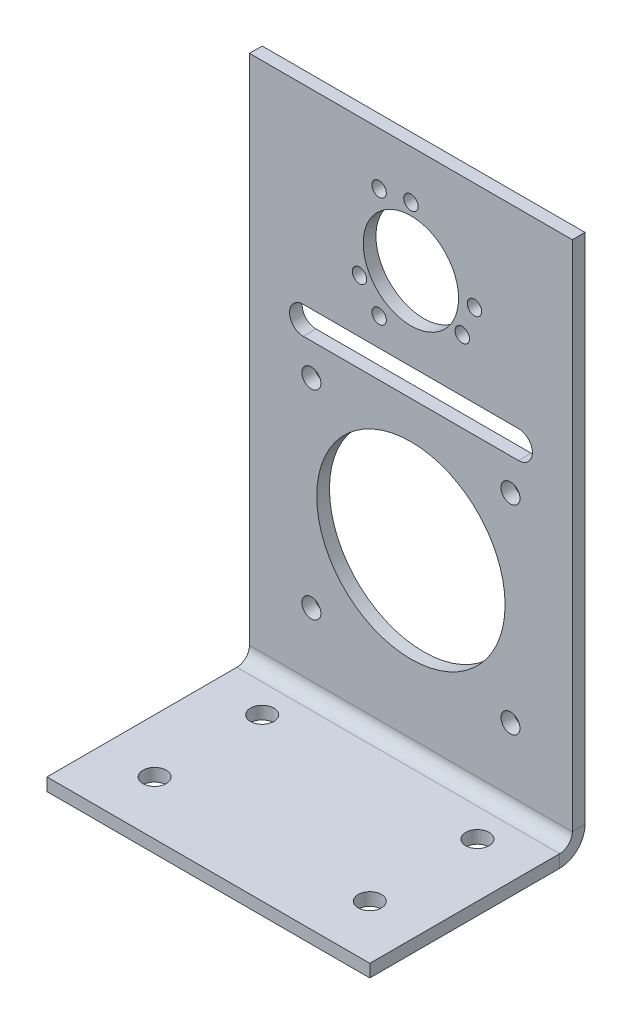
from build123d import *

# Parameters (mm, degrees)
SKETCH1_W                    = 76.2
SKETCH1_H                    = 50.8
BASE_FLANGE1_DEPTH           = 3
EDGE_FLANGE1_STRIP_W         = 18
EDGE_FLANGE1_STRIP_H         = 3
EDGE_FLANGE1_STRIP_CUT_DEPTH = 76.2
EDGE_FLANGE1_DEPTH           = 76.2
UNFOLD1_START                = -38.1
UNFOLD1_DEPTH                = 76.2
UNFOLD1_2_DEPTH              = 76.2
M5_CLEARANCE_HOLE1_D         = 5.5
M4_CLEARANCE_HOLE1_D         = 4.5
SKETCH15_R                   = 22.225
CUT_EXTRUDE1_DEPTH           = 153.340385686
M3_CLEARANCE_HOLE1_D         = 3.4
CIRPATTERN1_COUNT            = 3
SKETCH19_R                   = 11.25
CUT_EXTRUDE2_DEPTH           = 153.340385686
FOLD1_START                  = -147.468583471
FOLD1_OUTLINE_W              = 76.2
FOLD1_OUTLINE_H              = 3
FOLD1_DEPTH                  = 122.685023471
FOLD1_START_2                = -22.41644
FOLD1_2_OUTLINE_W            = 76.2
FOLD1_2_OUTLINE_H            = 124
FOLD1_2_OUTLINE_R            = 2.25
FOLD1_2_OUTLINE_R_2          = 22.225
FOLD1_2_OUTLINE_R_3          = 1.7
FOLD1_2_OUTLINE_R_4          = 11.25
FOLD1_2_DEPTH                = 0.01644
FOLD1_START_3                = -25.4
FOLD1_3_OUTLINE_W            = 76.2
FOLD1_3_OUTLINE_H            = 124
FOLD1_3_OUTLINE_R            = 2.25
FOLD1_3_OUTLINE_R_2          = 22.225
FOLD1_3_OUTLINE_R_3          = 1.7
FOLD1_3_OUTLINE_R_4          = 11.25
FOLD1_3_DEPTH                = 6
FOLD1_START_4                = -38.1
FOLD1_4_DEPTH                = 76.2


with BuildPart() as part:
    # Base-Flange1: sheet metal written as solids
    # Sketch1 → Base-Flange1 (new body)
    with BuildSketch(Plane(origin=(0, 0, 0), x_dir=(1, 0, 0), z_dir=(0, 1, 0))):
        Rectangle(SKETCH1_W, SKETCH1_H)
    extrude(amount=-BASE_FLANGE1_DEPTH)

    # Edge-Flange1: sheet metal written as solids
    # Edge-Flange1 strip (on a plane across the edge) → Edge-Flange1 strip cut (cut)
    with BuildSketch(Plane(origin=(38.1, 0, -25.4), x_dir=(0, 0, 1), z_dir=(-1, 0, 0))):
        with Locations((-3, -1.5)):
            Rectangle(EDGE_FLANGE1_STRIP_W, EDGE_FLANGE1_STRIP_H)
    extrude(amount=EDGE_FLANGE1_STRIP_CUT_DEPTH, mode=Mode.SUBTRACT)

    # Edge-Flange1 section (on a plane across the edge) → Edge-Flange1 (add)
    with BuildSketch(Plane(origin=(38.1, 0, -25.4), x_dir=(0, 0, 1), z_dir=(-1, 0, 0))):
        with BuildLine():
            Line((0, 3), (0, 124))
            Line((0, 124), (3, 124))
            Line((3, 124), (3, 3))
            ThreePointArc((3, 3), (3.878679656, 0.878679656), (6, 0))
            Line((6, 0), (6, -3))
            ThreePointArc((6, -3), (1.757359313, -1.242640687), (0, 3))
        make_face()
    extrude(amount=EDGE_FLANGE1_DEPTH)

    # Unfold1: read off the stored shape, not the designer's step
    # Unfold1 outline → Unfold1 (cut)
    with BuildSketch(Plane.YZ.offset(UNFOLD1_START)):
        with BuildLine():
            Line((0, -19.4), (0, -24.596152423))
            ThreePointArc((0, -24.596152423), (1.447085729, -25.195554958), (3, -25.4))
            Line((3, -25.4), (124, -25.4))
            Line((124, -25.4), (124, -22.4))
            Line((124, -22.4), (3, -22.4))
            ThreePointArc((3, -22.4), (0.878679656, -21.521320344), (0, -19.4))
        make_face()
    extrude(amount=UNFOLD1_DEPTH, mode=Mode.SUBTRACT)

    # Unfold1 2 outline → Unfold1 2 (add)
    with BuildSketch(Plane.YZ.offset(UNFOLD1_START)):
        with BuildLine():
            Line((-3, -19.4), (-3, -147.468583471))
            Line((-3, -147.468583471), (0, -147.468583471))
            Line((0, -147.468583471), (0, -24.596152423))
            ThreePointArc((0, -24.596152423), (-2.196152423, -22.4), (-3, -19.4))
        make_face()
    extrude(amount=UNFOLD1_2_DEPTH)

    # M5 Clearance Hole1 (through all)
    with Locations(Plane(origin=(0, 0, 0), x_dir=(1, 0, 0), z_dir=(0, 1, 0))):
        with Locations((-25.4, 12.7), (-25.4, -12.7), (25.4, -12.7), (25.4, 12.7)):
            Hole(M5_CLEARANCE_HOLE1_D / 2)

    # M4 Clearance Hole1 (through all)
    with Locations(Plane(origin=(0, 0, 0), x_dir=(1, 0, 0), z_dir=(0, 1, 0))):
        with Locations((-23.5, 41.418583471), (23.5, 88.418583471), (-23.5, 88.418583471), (23.5, 41.418583471)):
            Hole(M4_CLEARANCE_HOLE1_D / 2)

    # Sketch15 → Cut-Extrude1 (cut, through all)
    with BuildSketch(Plane(origin=(0, 0, 0), x_dir=(1, 0, 0), z_dir=(0, 1, 0))):
        with Locations(Location((0, 64.918583471, 0), (0, 0, 270))):
            Circle(SKETCH15_R)
    extrude(amount=-CUT_EXTRUDE1_DEPTH, mode=Mode.SUBTRACT)

    # M3 Clearance Hole1 (through all)
    with Locations(Plane(origin=(0, 0, 0), x_dir=(1, 0, 0), z_dir=(0, 1, 0))):
        with Locations((0, 136.068583471), (-7.5, 135.058964527)):
            m3_clearance_hole1 = Hole(M3_CLEARANCE_HOLE1_D / 2)

    # CirPattern1: M3 Clearance Hole1 ×3 about axis
    cirpattern1_axis = Axis((0, 0, -122.068583471), (0, 1, 0))
    for i in range(1, CIRPATTERN1_COUNT):
        add(m3_clearance_hole1.rotate(cirpattern1_axis, i * 360 / CIRPATTERN1_COUNT), mode=Mode.SUBTRACT)

    # Sketch19 → Cut-Extrude2 (cut, through all)
    with BuildSketch(Plane(origin=(0, 0, 0), x_dir=(1, 0, 0), z_dir=(0, 1, 0))):
        with Locations(Location((0, 122.068583471, 0), (0, 0, 270))):
            Circle(SKETCH19_R)
        with BuildLine():
            Line((-25.4, 102.512292942), (25.4, 102.512292942))
            ThreePointArc((25.4, 102.512292942), (28.6639, 99.248392942), (25.4, 95.984492942))
            Line((25.4, 95.984492942), (-25.4, 95.984492942))
            ThreePointArc((-25.4, 95.984492942), (-28.6639, 99.248392942), (-25.4, 102.512292942))
        make_face()
    extrude(amount=-CUT_EXTRUDE2_DEPTH, mode=Mode.SUBTRACT)

    # Fold1: read off the stored shape, not the designer's step
    # Fold1 outline → Fold1 (cut)
    with BuildSketch(Plane.XY.offset(FOLD1_START)):
        with Locations((0, -1.5)):
            Rectangle(FOLD1_OUTLINE_W, FOLD1_OUTLINE_H)
    extrude(amount=FOLD1_DEPTH, mode=Mode.SUBTRACT)

    # Fold1 2 outline → Fold1 2 (add)
    with BuildSketch(Plane.XY.offset(FOLD1_START_2)):
        with Locations((0, 62)):
            Rectangle(FOLD1_2_OUTLINE_W, FOLD1_2_OUTLINE_H)
        with Locations((-23.5, 17.95)):
            Circle(FOLD1_2_OUTLINE_R, mode=Mode.SUBTRACT)
        with Locations((23.5, 17.95)):
            Circle(FOLD1_2_OUTLINE_R, mode=Mode.SUBTRACT)
        with Locations((0, 41.45)):
            Circle(FOLD1_2_OUTLINE_R_2, mode=Mode.SUBTRACT)
        with Locations((-23.5, 64.95)):
            Circle(FOLD1_2_OUTLINE_R, mode=Mode.SUBTRACT)
        with Locations((-12.124355653, 91.6)):
            Circle(FOLD1_2_OUTLINE_R_3, mode=Mode.SUBTRACT)
        with Locations((-7.5, 85.609618943)):
            Circle(FOLD1_2_OUTLINE_R_3, mode=Mode.SUBTRACT)
        with Locations((-7.5, 111.590381057)):
            Circle(FOLD1_2_OUTLINE_R_3, mode=Mode.SUBTRACT)
        with BuildLine():
            ThreePointArc((-25.4, 72.515909472), (-28.6639, 75.779809472), (-25.4, 79.043709472))
            Line((-25.4, 79.043709472), (25.4, 79.043709472))
            ThreePointArc((25.4, 79.043709472), (28.6639, 75.779809472), (25.4, 72.515909472))
            Line((25.4, 72.515909472), (-25.4, 72.515909472))
        make_face(mode=Mode.SUBTRACT)
        with Locations((12.124355653, 91.6)):
            Circle(FOLD1_2_OUTLINE_R_3, mode=Mode.SUBTRACT)
        with Locations((23.5, 64.95)):
            Circle(FOLD1_2_OUTLINE_R, mode=Mode.SUBTRACT)
        with Locations((0, 98.6)):
            Circle(FOLD1_2_OUTLINE_R_4, mode=Mode.SUBTRACT)
        with Locations((15, 98.6)):
            Circle(FOLD1_2_OUTLINE_R_3, mode=Mode.SUBTRACT)
        with Locations((0, 112.6)):
            Circle(FOLD1_2_OUTLINE_R_3, mode=Mode.SUBTRACT)
    extrude(amount=FOLD1_2_DEPTH)

    # Fold1 3 outline → Fold1 3 (add)
    with BuildSketch(Plane.XY.offset(FOLD1_START_3)):
        with Locations((0, 62)):
            Rectangle(FOLD1_3_OUTLINE_W, FOLD1_3_OUTLINE_H)
        with Locations((-23.5, 17.95)):
            Circle(FOLD1_3_OUTLINE_R, mode=Mode.SUBTRACT)
        with Locations((23.5, 17.95)):
            Circle(FOLD1_3_OUTLINE_R, mode=Mode.SUBTRACT)
        with Locations((0, 41.45)):
            Circle(FOLD1_3_OUTLINE_R_2, mode=Mode.SUBTRACT)
        with Locations((-23.5, 64.95)):
            Circle(FOLD1_3_OUTLINE_R, mode=Mode.SUBTRACT)
        with Locations((-12.124355653, 91.6)):
            Circle(FOLD1_3_OUTLINE_R_3, mode=Mode.SUBTRACT)
        with Locations((-7.5, 85.609618943)):
            Circle(FOLD1_3_OUTLINE_R_3, mode=Mode.SUBTRACT)
        with Locations((-7.5, 111.590381057)):
            Circle(FOLD1_3_OUTLINE_R_3, mode=Mode.SUBTRACT)
        with BuildLine():
            ThreePointArc((-25.4, 72.515909472), (-28.6639, 75.779809472), (-25.4, 79.043709472))
            Line((-25.4, 79.043709472), (25.4, 79.043709472))
            ThreePointArc((25.4, 79.043709472), (28.6639, 75.779809472), (25.4, 72.515909472))
            Line((25.4, 72.515909472), (-25.4, 72.515909472))
        make_face(mode=Mode.SUBTRACT)
        with Locations((12.124355653, 91.6)):
            Circle(FOLD1_3_OUTLINE_R_3, mode=Mode.SUBTRACT)
        with Locations((23.5, 64.95)):
            Circle(FOLD1_3_OUTLINE_R, mode=Mode.SUBTRACT)
        with Locations((0, 98.6)):
            Circle(FOLD1_3_OUTLINE_R_4, mode=Mode.SUBTRACT)
        with Locations((15, 98.6)):
            Circle(FOLD1_3_OUTLINE_R_3, mode=Mode.SUBTRACT)
        with Locations((0, 112.6)):
            Circle(FOLD1_3_OUTLINE_R_3, mode=Mode.SUBTRACT)
    extrude(amount=FOLD1_3_DEPTH)

    # Fold1 4 outline → Fold1 4 (cut)
    with BuildSketch(Plane.YZ.offset(FOLD1_START_4)):
        with BuildLine():
            Line((124, -22.4), (124, -19.4))
            Line((124, -19.4), (0, -19.4))
            ThreePointArc((0, -19.4), (0.878679656, -21.521320344), (3, -22.4))
            Line((3, -22.4), (124, -22.4))
        make_face()
        with BuildLine():
            Line((0, -25.4), (3, -25.4))
            ThreePointArc((3, -25.4), (-1.242640687, -23.642640687), (-3, -19.4))
            Line((-3, -19.4), (-3, -24.78356))
            Line((-3, -24.78356), (0, -24.78356))
            Line((0, -24.78356), (0, -25.4))
        make_face()
    extrude(amount=FOLD1_4_DEPTH, mode=Mode.SUBTRACT)


solid = part.part
